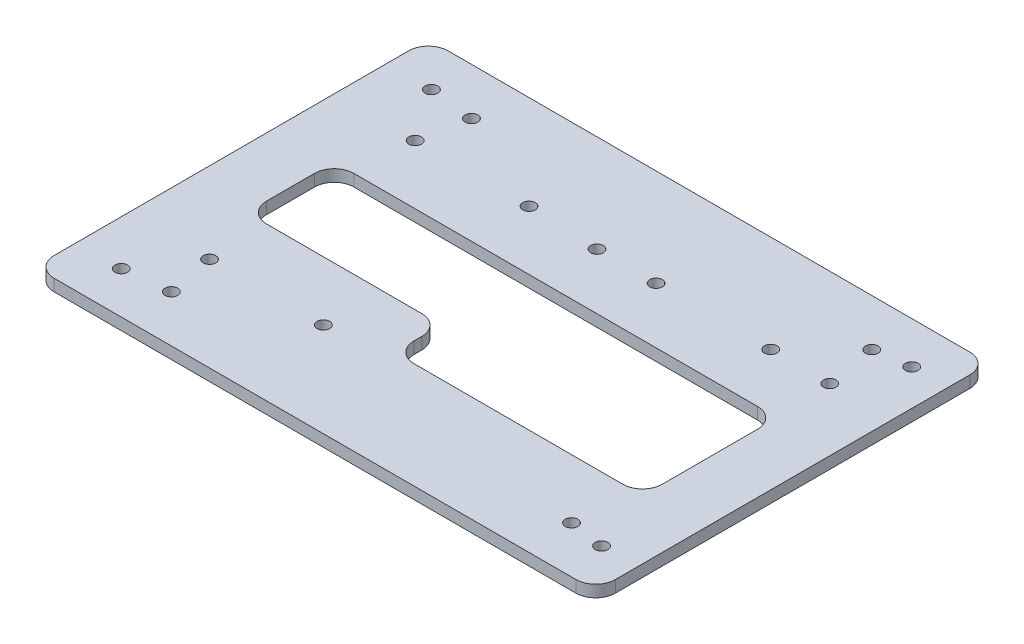
from build123d import *

# Parameters (mm, degrees)
SKETCH1_W                 = 160
SKETCH1_H                 = 100
BOSS_EXTRUDE1_DEPTH       = 3
SKETCH5_R                 = 1.6
CUT_EXTRUDE1_DEPTH        = 95.387499172
SKETCH_PATTERN1_OUTLINE_R = 1.6
SKETCH_PATTERN1_DEPTH     = 3
ZONA_GPIOS_W              = 17.53
ZONA_GPIOS_H              = 100
ZONAGPIOS_DEPTH           = 95.387499172
CUT_EXTRUDE4_DEPTH        = 95.387499172
FILLET1_R                 = 5


# Read off the part's stored shape, not the designer's step: Sketch-Pattern1
with BuildPart() as part:
    # Sketch1 → Boss-Extrude1 (new body)
    with BuildSketch(Plane(origin=(0, 0, 0), x_dir=(1, 0, 0), z_dir=(0, 1, 0))):
        Rectangle(SKETCH1_W, SKETCH1_H)
    extrude(amount=BOSS_EXTRUDE1_DEPTH)

    # Sketch5 → Cut-Extrude1 (cut, through all)
    with BuildSketch(Plane(origin=(0, 3, 0), x_dir=(1, 0, 0), z_dir=(0, 1, 0))):
        with Locations(Location((-68.58, 39.37, 0), (0, 0, 270))):
            Circle(SKETCH5_R)
    extrude(amount=-CUT_EXTRUDE1_DEPTH, mode=Mode.SUBTRACT)

    # Sketch-Pattern1 outline → Sketch-Pattern1 (cut)
    with BuildSketch(Plane(origin=(0, 0, 0), x_dir=(1, 0, 0), z_dir=(0, 1, 0))):
        with Locations((46.6, 25.3)):
            Circle(SKETCH_PATTERN1_OUTLINE_R)
        with Locations((-57.15, 38.1)):
            Circle(SKETCH_PATTERN1_OUTLINE_R)
        with Locations((-57.15, -38.1)):
            Circle(SKETCH_PATTERN1_OUTLINE_R)
        with Locations((44.45, -38.1)):
            Circle(SKETCH_PATTERN1_OUTLINE_R)
        with Locations((53.34, 39.37)):
            Circle(SKETCH_PATTERN1_OUTLINE_R)
        with Locations((53.34, -39.37)):
            Circle(SKETCH_PATTERN1_OUTLINE_R)
        with Locations((44.45, 38.1)):
            Circle(SKETCH_PATTERN1_OUTLINE_R)
        with Locations((-68.58, -39.37)):
            Circle(SKETCH_PATTERN1_OUTLINE_R)
        with Locations((-59.45, -26.1)):
            Circle(SKETCH_PATTERN1_OUTLINE_R)
        with Locations((-30.55, -26.1)):
            Circle(SKETCH_PATTERN1_OUTLINE_R)
        with Locations((-30.55, 26.1)):
            Circle(SKETCH_PATTERN1_OUTLINE_R)
        with Locations((-59.45, 26.1)):
            Circle(SKETCH_PATTERN1_OUTLINE_R)
        with Locations((-12.5, 25.3)):
            Circle(SKETCH_PATTERN1_OUTLINE_R)
        with Locations((2.5, 25.3)):
            Circle(SKETCH_PATTERN1_OUTLINE_R)
        with Locations((31.6, 25.3)):
            Circle(SKETCH_PATTERN1_OUTLINE_R)
    extrude(amount=SKETCH_PATTERN1_DEPTH, mode=Mode.SUBTRACT)

    # zona gpios → ZonaGPIOS (cut, through all)
    with BuildSketch(Plane(origin=(0, 3, 0), x_dir=(1, 0, 0), z_dir=(0, 1, 0))):
        with Locations((71.235, 0)):
            Rectangle(ZONA_GPIOS_W, ZONA_GPIOS_H)
    extrude(amount=-ZONAGPIOS_DEPTH, mode=Mode.SUBTRACT)

    # Sketch11 → Cut-Extrude4 (cut, through all)
    with BuildSketch(Plane(origin=(0, 3, 0), x_dir=(1, 0, 0), z_dir=(0, 1, 0))):
        Polygon((47.47, -23.1), (47.47, 11.1), (-65, 11.1), (-65, -11.1), (-15.55, -11.1), (-15.55, -23.1), align=None)
    extrude(amount=-CUT_EXTRUDE4_DEPTH, mode=Mode.SUBTRACT)

    # Fillet1
    fillet1_edges = [part.edges().sort_by_distance(p)[0] for p in [
        (47.47, 1.5, 23.1),
        (-15.55, 1.5, 23.1),
        (-15.55, 1.5, 11.1),
        (-65, 1.5, 11.1),
        (-65, 1.5, -11.1),
        (47.47, 1.5, -11.1),
        (-80, 1.5, 50),
        (-80, 1.5, -50),
        (62.47, 1.5, 50),
        (62.47, 1.5, -50),
    ]]
    fillet(fillet1_edges, radius=FILLET1_R)


solid = part.part
